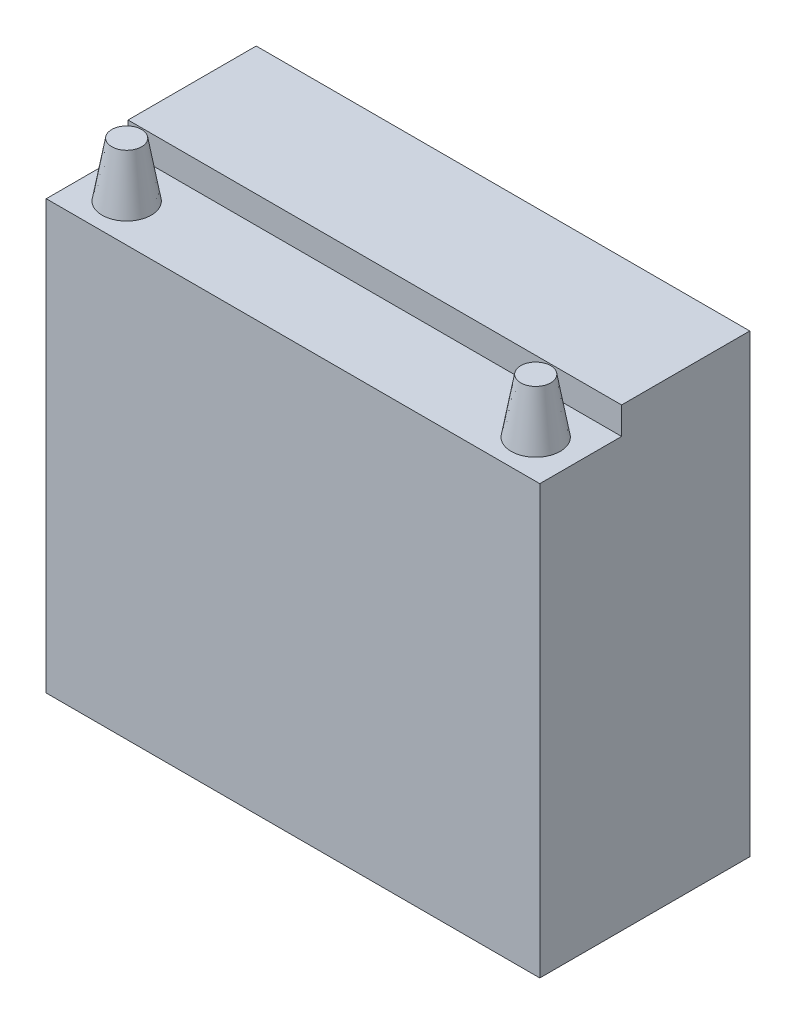
from build123d import *

# Parameters (mm, degrees)
ESBO_O1_W                = 181
ESBO_O1_H                = 167
RESSALTO_EXTRUS_O1_DEPTH = 77
ESBO_O2_W                = 30.000000008
ESBO_O2_H                = 10.00000002
CORTE_EXTRUS_O1_DEPTH    = 251.380240594


with BuildPart() as part:
    # Esboço1 → Ressalto-extrusão1 (new body)
    with BuildSketch(Plane(origin=(0, 0, -45.169291339), x_dir=(-1, 0, 0), z_dir=(0, 0, -1))):
        with Locations((-13.5, 83.5)):
            Rectangle(ESBO_O1_W, ESBO_O1_H)
    extrude(amount=-RESSALTO_EXTRUS_O1_DEPTH)

    # Esboço2 → Corte-extrusão1 (cut, through all)
    with BuildSketch(Plane.ZY.offset(77)):
        with Locations((16.830708657, 161.99999999)):
            Rectangle(ESBO_O2_W, ESBO_O2_H)
    extrude(amount=-CORTE_EXTRUS_O1_DEPTH, mode=Mode.SUBTRACT)

    # Esboço3 → Revolução1 (revolve)
    with BuildSketch(Plane(origin=(0, 0, 17.830708661), x_dir=(-1, 0, 0), z_dir=(0, 0, -1))):
        Polygon((-97.5, 157), (-88.5, 157), (-88.5, 177), (-93.973460386, 177), align=None)
    revolve(axis=Axis((88.5, 157, 17.830708661), (0, 1, 0)))

    # Esboço4 → Revolução2 (revolve)
    with BuildSketch(Plane(origin=(0, 0, 17.830708661), x_dir=(-1, 0, 0), z_dir=(0, 0, -1))):
        Polygon((52.5, 157), (61.5, 157), (61.5, 177), (56.026539614, 177), align=None)
    revolve(axis=Axis((-61.5, 157, 17.830708661), (0, 1, 0)))


solid = part.part
